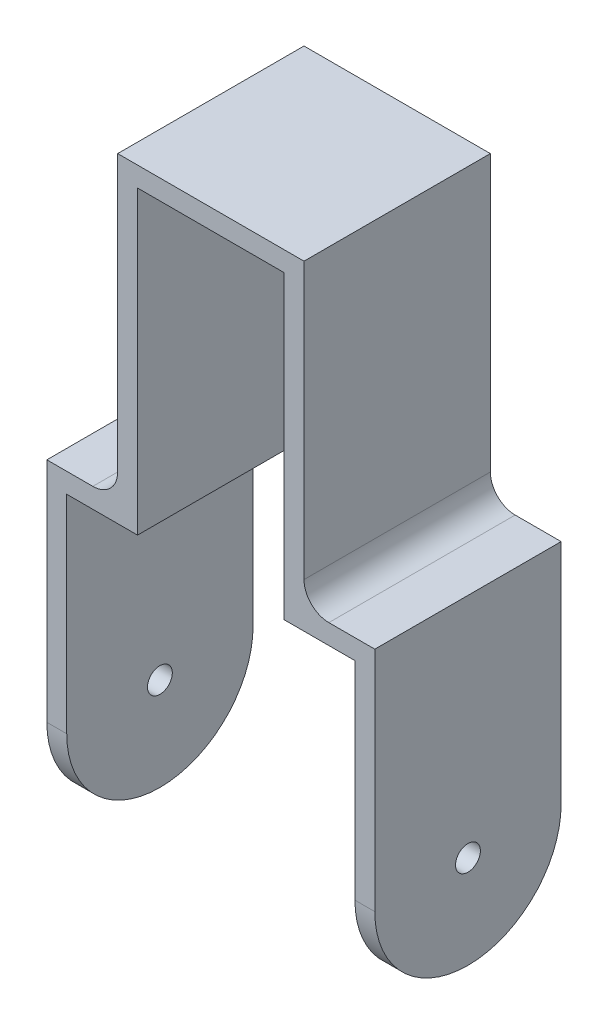
from build123d import *

# Parameters (mm, degrees)
BOSS_EXTRUDE2_DEPTH     = 75
CUT_EXTRUDE1_DEPTH      = 148
CUT_EXTRUDE1_DEPTH_BACK = 47
SKETCH2_R               = 5
FILLET1_R               = 37.5
FILLET2_R               = 10


with BuildPart() as part:
    # Sketch1 → Boss-Extrude2 (new body)
    with BuildSketch(Plane.XY):
        Polygon((8, -117), (8, -8), (67, -8), (67, -117), (67, -121), (67, -129), (95.5, -129), (95.5, -250), (103.5, -250), (103.5, -121), (75, -121), (75, -8), (75, 0), (67, 0), (8, 0), (0, 0), (0, -8), (0, -121), (-28.5, -121), (-28.5, -250), (-20.5, -250), (-20.5, -129), (8, -129), (8, -125), (8, -121), align=None)
    extrude(amount=BOSS_EXTRUDE2_DEPTH)

    # Sketch2 → Cut-Extrude1 (cut, two sides: drawn at the far end of the back side and taken through both)
    with BuildSketch(Plane(origin=(0, 0, 0), x_dir=(0, 0, -1), z_dir=(1, 0, 0)).offset(-CUT_EXTRUDE1_DEPTH_BACK)):
        with Locations(Location((-37.5, -212.5, 0), (0, 0, 90))):
            Circle(SKETCH2_R)
    extrude(amount=CUT_EXTRUDE1_DEPTH + CUT_EXTRUDE1_DEPTH_BACK, mode=Mode.SUBTRACT)

    # Fillet1
    fillet1_edges = [part.edges().sort_by_distance(p)[0] for p in [
        (-24.5, -250, 0),
        (-24.5, -250, 75),
        (99.5, -250, 0),
        (99.5, -250, 75),
    ]]
    fillet(fillet1_edges, radius=FILLET1_R - 0.0001)  # a hair under: the kernel refuses the full size

    # Fillet2
    fillet2_edges = [part.edges().sort_by_distance(p)[0] for p in [
        (0, -121, 37.5),
        (75, -121, 37.5),
    ]]
    fillet(fillet2_edges, radius=FILLET2_R)


solid = part.part
